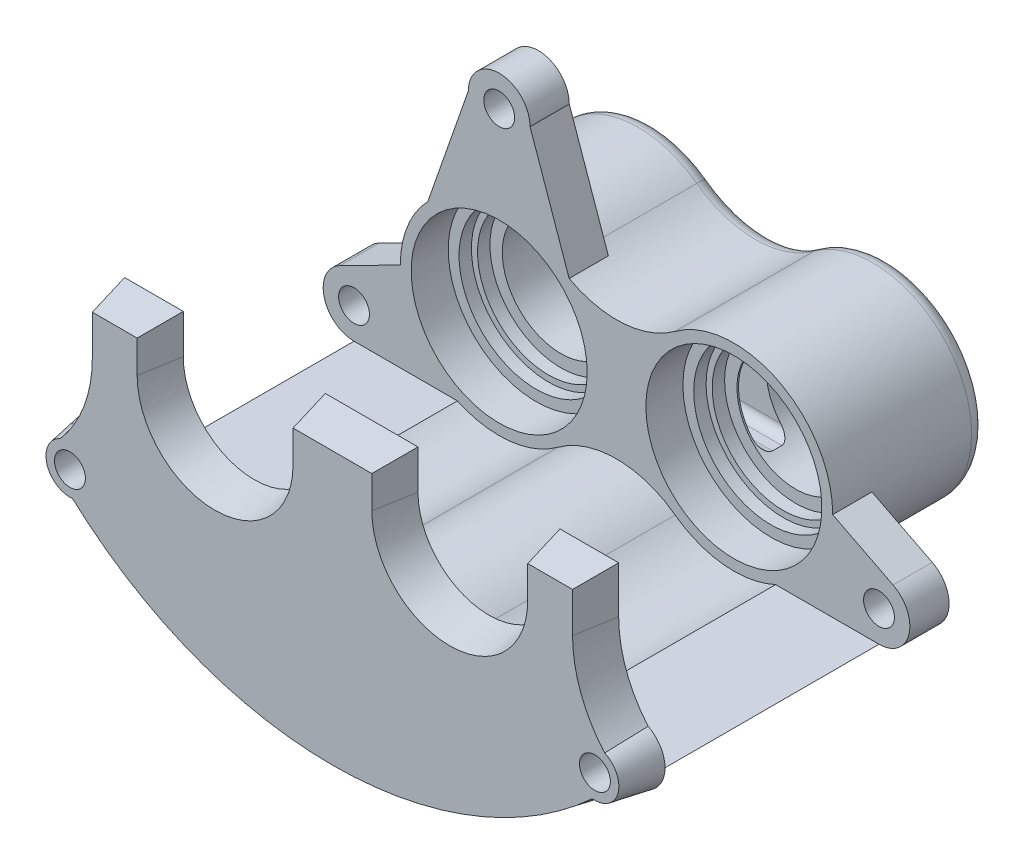
from build123d import *

# Parameters (mm, degrees)
BOSS_EXTRUDE1_DEPTH                 = 12.5
CUT_EXTRUDE1_REACH                  = 42.463
CUT_EXTRUDE1_END_RADIUS             = 9.5
CUT_EXTRUDE1_DIRECTION_2_REACH      = 42.463
CUT_EXTRUDE1_DIRECTION_2_END_RADIUS = 9.5
BOSS_EXTRUDE2_DEPTH                 = 6.35
SKETCH6_R                           = 2.5
BOSS_EXTRUDE3_DEPTH                 = 6.35
BOSS_EXTRUDE4_START                 = -46
BOSS_EXTRUDE4_DEPTH                 = 46
BOSS_EXTRUDE5_DEPTH                 = 6.35
BOSS_EXTRUDE5_DRAFT                 = 10
HOLE1_START                         = 6.15
HOLE1_OUTLINE_R                     = 2.5
HOLE1_DEPTH                         = 52.35
FILLET1_R                           = 2.5


# Read off the part's stored shape, not the designer's step: Hole1
with BuildPart() as part:
    # Sketch1 → Boss-Extrude1 (new, symmetric)
    with BuildSketch(Plane.XY):
        with BuildLine():
            ThreePointArc((-9.5, 12.87439319), (-35, 0), (-9.5, -12.87439319))
            ThreePointArc((-9.5, -12.87439319), (0, -9.748786379), (9.5, -12.87439319))
            ThreePointArc((9.5, -12.87439319), (35, 0), (9.5, 12.87439319))
            ThreePointArc((9.5, 12.87439319), (0, 9.748786379), (-9.5, 12.87439319))
        make_face()
    extrude(amount=BOSS_EXTRUDE1_DEPTH, both=True)

    # Sketch2 → Cut-Revolve1 (revolve, cut)
    with BuildSketch(Plane(origin=(19, 0, 0), x_dir=(0, 0, -1), z_dir=(1, 0, 0)), mode=Mode.PRIVATE) as cut_revolve1_sk:
        Polygon((-12.5, 0), (-12.5, 14.25), (-6.5, 14.25), (-6.5, 12.5), (-4.5, 12.5), (-4.5, 11.5), (-2.5, 11.5), (-2.5, 9.5), (9.5, 9.5), (9.5, 4.5), (8.5, 4.5), (8.5, 0), align=None)
    cut_revolve1 = revolve(cut_revolve1_sk.sketch.rotate(Axis((19, 0, -12.5), (0, 0, 1)), 90), axis=Axis((19, 0, -12.5), (0, 0, 1)), mode=Mode.SUBTRACT)

    # Mirror1: Cut-Revolve1 across plane
    add(cut_revolve1.mirror(Plane(origin=(0, 0, 0), x_dir=(0, 0, 1), z_dir=(1, 0, 0))), mode=Mode.SUBTRACT)

    # Cut-Extrude1: up to this cylinder (the profile starts outside it)
    cut_extrude1_end = Plane(origin=(19, 0, 0), z_dir=(0, 0, -1)) * Cylinder(CUT_EXTRUDE1_END_RADIUS, 104.926, mode=Mode.PRIVATE)
    # Sketch3 → Cut-Extrude1 (cut, up to the surface)
    with BuildSketch(Plane(origin=(0, 0, 0), x_dir=(0, 0, -1), z_dir=(1, 0, 0)), mode=Mode.PRIVATE) as cut_extrude1_sk1:
        with BuildLine():
            Line((-0.75, -7.75), (0.75, -7.75))
            ThreePointArc((0.75, -7.75), (1.810660172, -7.310660172), (2.25, -6.25))
            Line((2.25, -6.25), (2.25, 6.25))
            ThreePointArc((2.25, 6.25), (1.810660172, 7.310660172), (0.75, 7.75))
            Line((0.75, 7.75), (-0.75, 7.75))
            ThreePointArc((-0.75, 7.75), (-1.810660172, 7.310660172), (-2.25, 6.25))
            Line((-2.25, 6.25), (-2.25, -6.25))
            ThreePointArc((-2.25, -6.25), (-1.810660172, -7.310660172), (-0.75, -7.75))
        make_face()
    cut_extrude1_tool1 = extrude(cut_extrude1_sk1.sketch, amount=CUT_EXTRUDE1_REACH, mode=Mode.PRIVATE) - cut_extrude1_end
    add(cut_extrude1_tool1.solids().sort_by_distance((0, 0, 0))[0], mode=Mode.SUBTRACT)

    # Cut-Extrude1 direction 2: up to this cylinder (the profile starts outside it)
    cut_extrude1_direction_2_end = Plane(origin=(-19, 0, 0), z_dir=(0, 0, -1)) * Cylinder(CUT_EXTRUDE1_DIRECTION_2_END_RADIUS, 104.926, mode=Mode.PRIVATE)
    # Sketch3 → Cut-Extrude1 direction 2 (cut, up to the surface)
    with BuildSketch(Plane(origin=(0, 0, 0), x_dir=(0, 0, -1), z_dir=(1, 0, 0)), mode=Mode.PRIVATE) as cut_extrude1_direction_2_sk1:
        with BuildLine():
            Line((-0.75, -7.75), (0.75, -7.75))
            ThreePointArc((0.75, -7.75), (1.810660172, -7.310660172), (2.25, -6.25))
            Line((2.25, -6.25), (2.25, 6.25))
            ThreePointArc((2.25, 6.25), (1.810660172, 7.310660172), (0.75, 7.75))
            Line((0.75, 7.75), (-0.75, 7.75))
            ThreePointArc((-0.75, 7.75), (-1.810660172, 7.310660172), (-2.25, 6.25))
            Line((-2.25, 6.25), (-2.25, -6.25))
            ThreePointArc((-2.25, -6.25), (-1.810660172, -7.310660172), (-0.75, -7.75))
        make_face()
    cut_extrude1_direction_2_tool1 = extrude(cut_extrude1_direction_2_sk1.sketch, amount=-CUT_EXTRUDE1_DIRECTION_2_REACH, mode=Mode.PRIVATE) - cut_extrude1_direction_2_end
    add(cut_extrude1_direction_2_tool1.solids().sort_by_distance((0, 0, 0))[0], mode=Mode.SUBTRACT)

    # Sketch5 → Boss-Extrude2 (add)
    with BuildSketch(Plane.XY.offset(12.5)):
        with BuildLine():
            Line((-44.769952499, -5.044967379), (-34.999860317, -0.066856769))
            ThreePointArc((-34.999860317, -0.066856769), (-32.476862137, -8.624047016), (-25.763874629, -14.5))
            Line((-25.763874629, -14.5), (-42.5, -14.5))
            ThreePointArc((-42.5, -14.5), (-47.361849602, -10.667226819), (-44.769952499, -5.044967379))
        make_face()
    boss_extrude2 = extrude(amount=-BOSS_EXTRUDE2_DEPTH)

    # Mirror2: Boss-Extrude2 across plane
    add(boss_extrude2.mirror(Plane(origin=(0, 0, 0), x_dir=(0, 0, 1), z_dir=(1, 0, 0))))

    # Sketch6 → Boss-Extrude3 (add)
    with BuildSketch(Plane.XY.offset(12.5)):
        with BuildLine():
            Line((-24, 29.83), (-30.550716865, 11.071627699))
            ThreePointArc((-30.550716865, 11.071627699), (-20.3652292, 15.94164826), (-9.5, 12.87439319))
            ThreePointArc((-9.5, 12.87439319), (-8.605515622, 12.260083666), (-7.671449956, 11.707815773))
            Line((-7.671449956, 11.707815773), (-14, 29.83))
            ThreePointArc((-14, 29.83), (-19, 34.83), (-24, 29.83))
        make_face()
        with Locations((-19, 29.83)):
            Circle(SKETCH6_R, mode=Mode.SUBTRACT)
    extrude(amount=-BOSS_EXTRUDE3_DEPTH)

    # Sketch8 → Boss-Extrude4 (add)
    with BuildSketch(Plane(origin=(0, 0, 6.15), x_dir=(-1, 0, 0), z_dir=(0, 0, -1)).offset(BOSS_EXTRUDE4_START)):
        with BuildLine():
            Line((42.5, -14.5), (25.763874629, -14.5))
            ThreePointArc((25.763874629, -14.5), (17.40869711, -15.920670687), (9.5, -12.87439319))
            ThreePointArc((9.5, -12.87439319), (0, -9.748786379), (-9.5, -12.87439319))
            ThreePointArc((-9.5, -12.87439319), (-17.40869711, -15.920670687), (-25.763874629, -14.5))
            Line((-25.763874629, -14.5), (-42.5, -14.5))
            ThreePointArc((-42.5, -14.5), (0, -30.819495552), (42.5, -14.5))
        make_face()
    extrude(amount=BOSS_EXTRUDE4_DEPTH)


with BuildPart() as boss_extrude5_tool:
    # Sketch9 → Boss-Extrude5 (with draft: the straight prism first)
    with BuildSketch(Plane.XY.offset(52.15)):
        with BuildLine():
            Line((-7.5, 15.5), (-7.5, 9.15))
            ThreePointArc((-7.5, 9.15), (-19, -2.35), (-30.5, 9.15))
            Line((-30.5, 9.15), (-30.5, 15.5))
            Line((-30.5, 15.5), (-40, 15.5))
            Line((-40, 15.5), (-40, 7.918275005))
            ThreePointArc((-40, 7.918275005), (-41.230330983, 1.011790734), (-44.769952499, -5.044967379))
            ThreePointArc((-44.769952499, -5.044967379), (-47.361849602, -10.667226819), (-42.5, -14.5))
            ThreePointArc((-42.5, -14.5), (0, -30.819495552), (42.5, -14.5))
            ThreePointArc((42.5, -14.5), (47.361849602, -10.667226819), (44.769952499, -5.044967379))
            ThreePointArc((44.769952499, -5.044967379), (41.230330983, 1.011790734), (40, 7.918275005))
            Line((40, 7.918275005), (40, 15.5))
            Line((40, 15.5), (30.5, 15.5))
            Line((30.5, 15.5), (30.5, 9.15))
            ThreePointArc((30.5, 9.15), (19, -2.35), (7.5, 9.15))
            Line((7.5, 9.15), (7.5, 15.5))
            Line((7.5, 15.5), (-7.5, 15.5))
        make_face()
    extrude(amount=BOSS_EXTRUDE5_DEPTH)
    # Boss-Extrude5: the draft: its side faces are tilted about the plane it starts from
    boss_extrude5_sides = [boss_extrude5_tool.faces().sort_by_distance(p)[0] for p in [
        (41.230330983, 1.011790734, 55.325),
        (40, 11.709137503, 55.325),
        (35.25, 15.5, 55.325),
        (30.5, 12.325, 55.325),
        (19, -2.35, 55.325),
        (7.5, 12.325, 55.325),
        (0, 15.5, 55.325),
        (-7.5, 12.325, 55.325),
        (-19, -2.35, 55.325),
        (-30.5, 12.325, 55.325),
        (-35.25, 15.5, 55.325),
        (-40, 11.709137503, 55.325),
        (-41.230330983, 1.011790734, 55.325),
        (-47.361849602, -10.667226819, 55.325),
        (0, -30.819495552, 55.325),
        (47.361849602, -10.667226819, 55.325),
    ]]
    draft(boss_extrude5_sides, Plane.XY.offset(52.15), BOSS_EXTRUDE5_DRAFT)


with BuildPart() as part_1:
    add(part.part)

    # Boss-Extrude5: add boss_extrude5_tool
    add(boss_extrude5_tool.part)

    # Hole1 outline → Hole1 (cut)
    with BuildSketch(Plane.XY.offset(HOLE1_START)):
        with Locations((-42.5, -9.5)):
            Circle(HOLE1_OUTLINE_R)
    hole1 = extrude(amount=HOLE1_DEPTH, mode=Mode.SUBTRACT)

    # Mirror3: Hole1 across plane
    add(hole1.mirror(Plane(origin=(0, 0, 0), x_dir=(0, 0, 1), z_dir=(1, 0, 0))), mode=Mode.SUBTRACT)

    # Fillet1
    fillet1_edges = [part_1.edges().sort_by_distance(p)[0] for p in [
        (35, 0, -12.5),
        (0, -9.748786379, -12.5),
        (-35, 0, -12.5),
        (0, 9.748786379, -12.5),
    ]]
    fillet(fillet1_edges, radius=FILLET1_R)


solid = part_1.part
